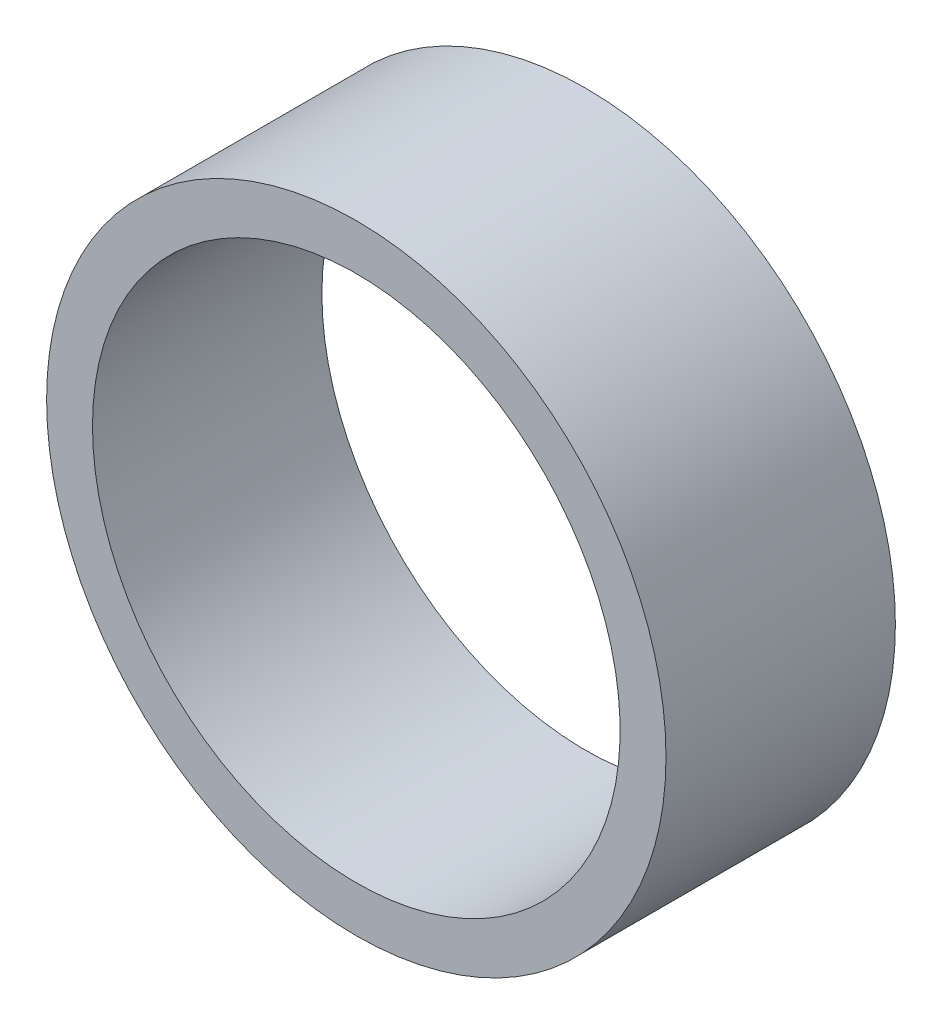
from build123d import *

# Parameters (mm, degrees)
SKETCH1_R           = 1.35
BOSS_EXTRUDE1_DEPTH = 1
SKETCH2_R           = 1.15
CUT_EXTRUDE1_DEPTH  = 3.155226206


with BuildPart() as part:
    # Sketch1 → Boss-Extrude1 (new body)
    with BuildSketch(Plane.XY):
        Circle(SKETCH1_R)
    extrude(amount=-BOSS_EXTRUDE1_DEPTH)

    # Sketch2 → Cut-Extrude1 (cut, through all)
    with BuildSketch(Plane(origin=(0, 0, -1), x_dir=(-1, 0, 0), z_dir=(0, 0, -1))):
        Circle(SKETCH2_R)
    extrude(amount=-CUT_EXTRUDE1_DEPTH, mode=Mode.SUBTRACT)


solid = part.part
